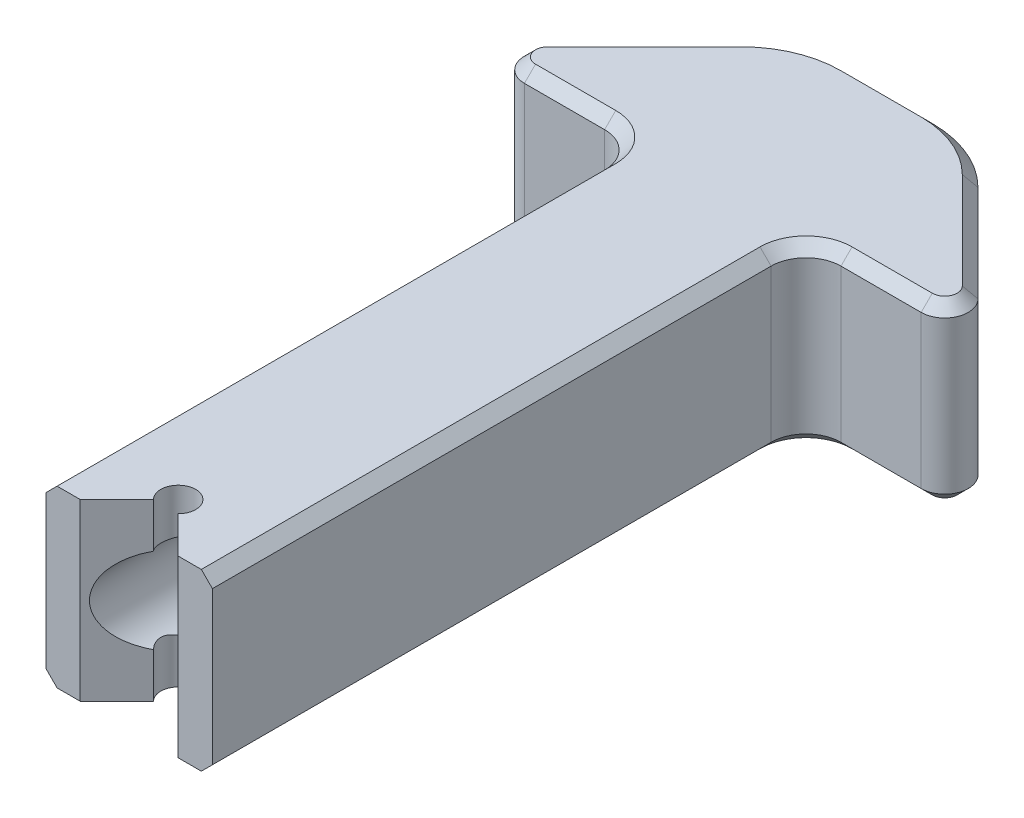
from build123d import *

# Parameters (mm, degrees)
SKETCH1_R           = 1.077630735
BOSS_EXTRUDE1_DEPTH = 8.001
SKETCH4_R           = 2.032
CUT_EXTRUDE1_DEPTH  = 50.8
SKETCH5_R           = 3.048
CUT_EXTRUDE2_DEPTH  = 4.572
CUT_EXTRUDE4_DEPTH  = 34.909144773
FILLET2_R           = 5.08
FILLET3_R           = 1.6002
CHAMFER1_SIZE       = 0.508


with BuildPart() as part:
    # Sketch1 → Boss-Extrude1 (new body)
    with BuildSketch(Plane(origin=(0, 0, 0), x_dir=(1, 0, 0), z_dir=(0, 1, 0))):
        with BuildLine():
            Line((-0.609859659, 0), (0, 0))
            Line((0, 0), (4.662509606, 0))
            Line((4.662509606, 0), (4.662509606, -27.178))
            Line((4.662509606, -27.178), (8.472509606, -27.178))
            Line((8.472509606, -27.178), (8.472509606, 7.747))
            Line((8.472509606, 7.747), (4.535509606, 7.747))
            Line((4.535509606, 7.747), (-1.371859637, 1.839630756))
            ThreePointArc((-1.371859637, 1.839630756), (-0.197468217, 2.073231708), (0.467771075, 1.077630735))
            ThreePointArc((0.467771075, 1.077630735), (0.152140341, 0.315630735), (-0.609859659, 0))
        make_face()
        with Locations((-0.609859659, 1.077630735)):
            Circle(SKETCH1_R)
    boss_extrude1 = extrude(amount=BOSS_EXTRUDE1_DEPTH)

    # Mirror1: Boss-Extrude1 across plane
    add(boss_extrude1.mirror(Plane(origin=(8.472509606, 0, 0), x_dir=(0, 0, 1), z_dir=(1, 0, 0))))

    # Sketch4 → Cut-Extrude1 (cut)
    with BuildSketch(Plane(origin=(0, 0, -7.747), x_dir=(-1, 0, 0), z_dir=(0, 0, -1))):
        with Locations((-8.472509606, 4.0005)):
            Circle(SKETCH4_R)
    extrude(amount=-CUT_EXTRUDE1_DEPTH, mode=Mode.SUBTRACT)

    # Sketch5 → Cut-Extrude2 (cut)
    with BuildSketch(Plane(origin=(0, 0, -7.747), x_dir=(-1, 0, 0), z_dir=(0, 0, -1))):
        with Locations((-8.472509606, 4.0005)):
            Circle(SKETCH5_R)
    extrude(amount=-CUT_EXTRUDE2_DEPTH, mode=Mode.SUBTRACT)

    # Sketch7 → Cut-Extrude4 (cut, through all)
    with BuildSketch(Plane(origin=(0, 8.001, 0), x_dir=(1, 0, 0), z_dir=(0, 1, 0))):
        with BuildLine():
            ThreePointArc((9.272609606, -24.93293597), (8.166324592, -24.193739956), (7.906753471, -25.498692105))
            Line((7.906753471, -25.498692105), (8.472509606, -24.93293597))
            Line((8.472509606, -24.93293597), (9.038265742, -25.498692105))
            ThreePointArc((9.038265742, -25.498692105), (9.21170562, -25.239120984), (9.272609606, -24.93293597))
        make_face()
        with BuildLine():
            Line((8.472509606, -24.93293597), (7.906753471, -25.498692105))
            ThreePointArc((7.906753471, -25.498692105), (8.472509606, -25.73303597), (9.038265742, -25.498692105))
            Line((9.038265742, -25.498692105), (8.472509606, -24.93293597))
        make_face()
        with BuildLine():
            Line((7.906753471, -25.498692105), (6.227445576, -27.178))
            Line((6.227445576, -27.178), (10.717573636, -27.178))
            Line((10.717573636, -27.178), (9.038265742, -25.498692105))
            ThreePointArc((9.038265742, -25.498692105), (8.472509606, -25.73303597), (7.906753471, -25.498692105))
        make_face()
    extrude(amount=-CUT_EXTRUDE4_DEPTH, mode=Mode.SUBTRACT)

    # Fillet2
    # the kernel refuses this fillet: 5.08 mm, written as the material it takes off along each edge
    with BuildSketch(Plane(origin=(4.535509606, -5.260512242, -7.747), x_dir=(-0.7071067811865458, 0, 0.7071067811865495), z_dir=(0, 1, 0)), Plane(origin=(12.409509606, -5.260512242, -7.747), x_dir=(-1, 0, 0), z_dir=(0, 1, 0))) as fillet2_piece_1:
        with BuildLine():
            CenterArc((FILLET2_R * 0.414213562373, FILLET2_R), FILLET2_R, 225, 45)
            Line((-FILLET2_R * 0.292893218813, FILLET2_R * 0.292893218813), (0, 0))
            Line((0, 0), (FILLET2_R * 0.414213562373, 0))
        make_face()
    extrude(amount=18.522024484, mode=Mode.SUBTRACT)

    # Fillet3
    fillet3_edges = [part.edges().sort_by_distance(p)[0] for p in [
        (4.662509606, 4.0005, 0),
        (12.282509606, 4.0005, 0),
    ]]
    fillet(fillet3_edges, radius=FILLET3_R)

    # Chamfer1
    chamfer1_edges = [part.edges().sort_by_distance(p)[0] for p in [
        (15.718794239, 0, 0),
        (15.718794239, 8.001, 0),
        (12.282509606, 0, 14.3891),
        (12.282509606, 8.001, 14.3891),
        (4.662509606, 0, 14.3891),
        (4.662509606, 8.001, 14.3891),
        (-1.605460644, 0, -0.66523932),
        (1.226224973, 0, 0),
        (1.226224973, 8.001, 0),
        (12.751197335, 0, 0.468687729),
        (12.751197335, 8.001, 0.468687729),
        (4.193821877, 0, 0.468687729),
        (4.193821877, 8.001, 0.468687729),
        (0.837876209, 0, -4.049366602),
        (16.107143004, 0, -4.049366602),
        (18.550479857, 8.001, -0.66523932),
        (16.107143004, 8.001, -4.049366602),
        (18.550479857, 0, -0.66523932),
        (0.837876209, 8.001, -4.049366602),
        (-1.605460644, 8.001, -0.66523932),
        (8.472509606, 0, -7.747),
        (12.249336546, 0, -7.360308025),
        (4.695682667, 0, -7.360308025),
        (8.472509606, 8.001, -7.747),
        (12.249336546, 8.001, -7.360308025),
        (4.695682667, 8.001, -7.360308025),
    ]]
    chamfer(chamfer1_edges, length=CHAMFER1_SIZE)


solid = part.part
